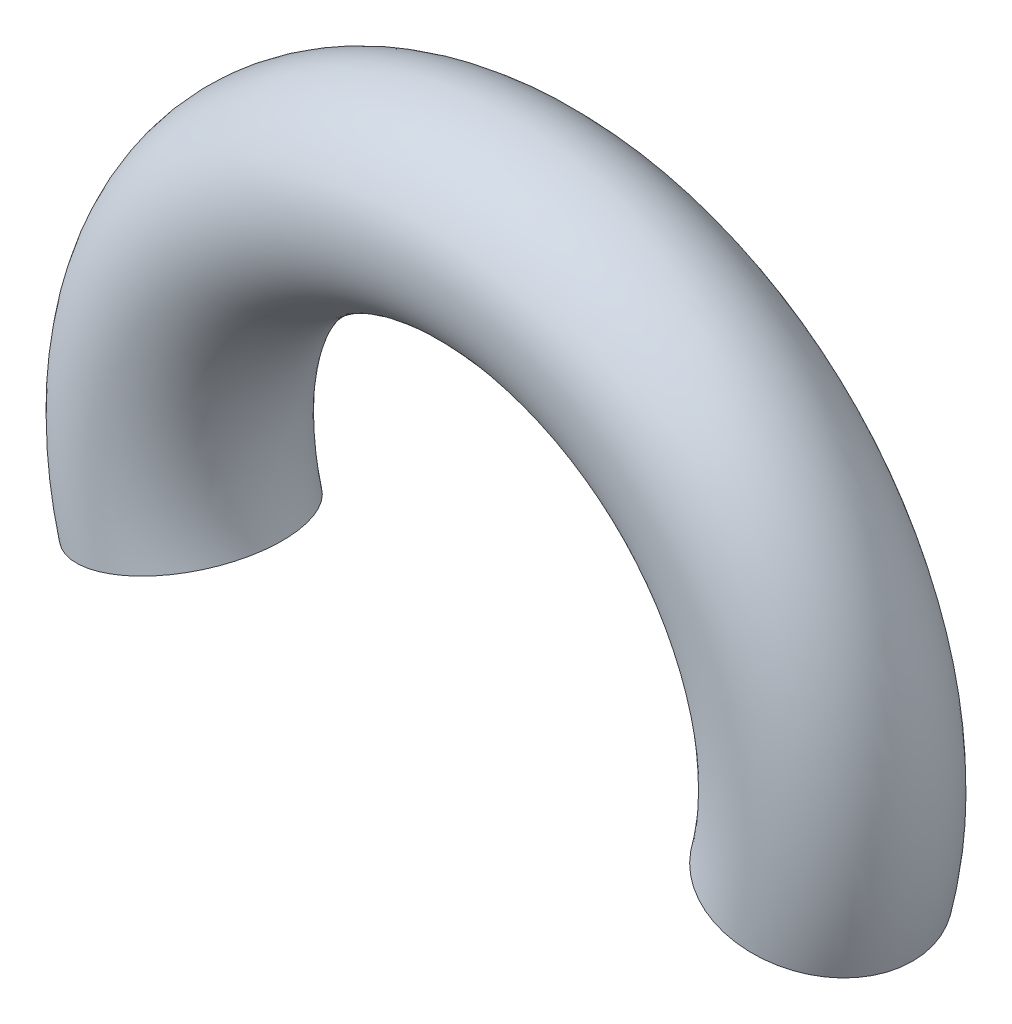
from build123d import *

# Parameters (mm, degrees)
SWEEP_3_OUTLINE_R = 29
SWEEP_3_ANGLE     = 210
SHELL_1_T         = -3


# Read off the part's stored shape, not the designer's step: 扫描3
with BuildPart() as part:
    # 扫描3 outline → 扫描3 (revolve)
    with BuildSketch(Plane(origin=(0, 0, 0), x_dir=(0.9659258262890679, -0.2588190451025222, 0), z_dir=(-0.2588190451025222, -0.9659258262890679, 0))):
        with Locations((100, 0)):
            Circle(SWEEP_3_OUTLINE_R)
    revolve(axis=Axis((0, 0, 0), (0, 0, 1)), revolution_arc=SWEEP_3_ANGLE)

    # 抽壳1
    shell_1_openings = [part.faces().sort_by_distance(p)[0] for p in [
        (96.592582629, -25.88190451, 0),
        (-96.592582629, -25.88190451, 0),
    ]]
    offset(amount=SHELL_1_T, openings=shell_1_openings, kind=Kind.INTERSECTION)


solid = part.part
